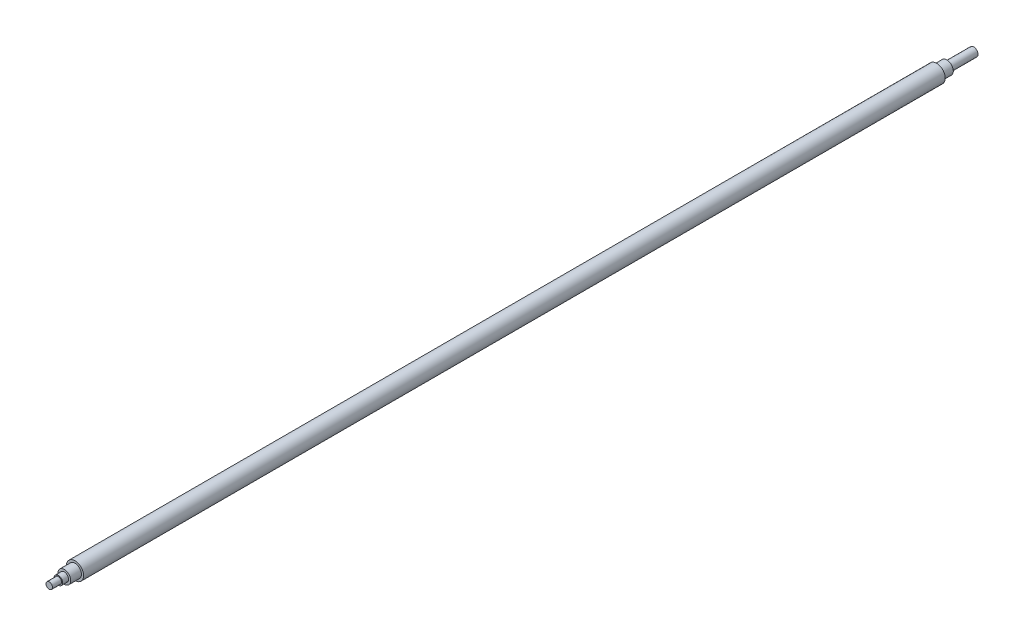
from build123d import *


with BuildPart() as part:
    # Schizzo2 → Rivoluzione2 (revolve)
    with BuildSketch(Plane(origin=(0, 0, 0), x_dir=(0, 0, -1), z_dir=(1, 0, 0))):
        Polygon((0, 0), (0, 3), (8.5, 3), (8.5, 4), (14, 4), (14, 6), (24, 6), (24, 8), (826, 8), (826, 6), (835.5, 6), (835.5, 4), (860.5, 4), (860.5, 0), align=None)
    revolve(axis=Axis((0, 0, 0), (0, 0, -1)))


solid = part.part
